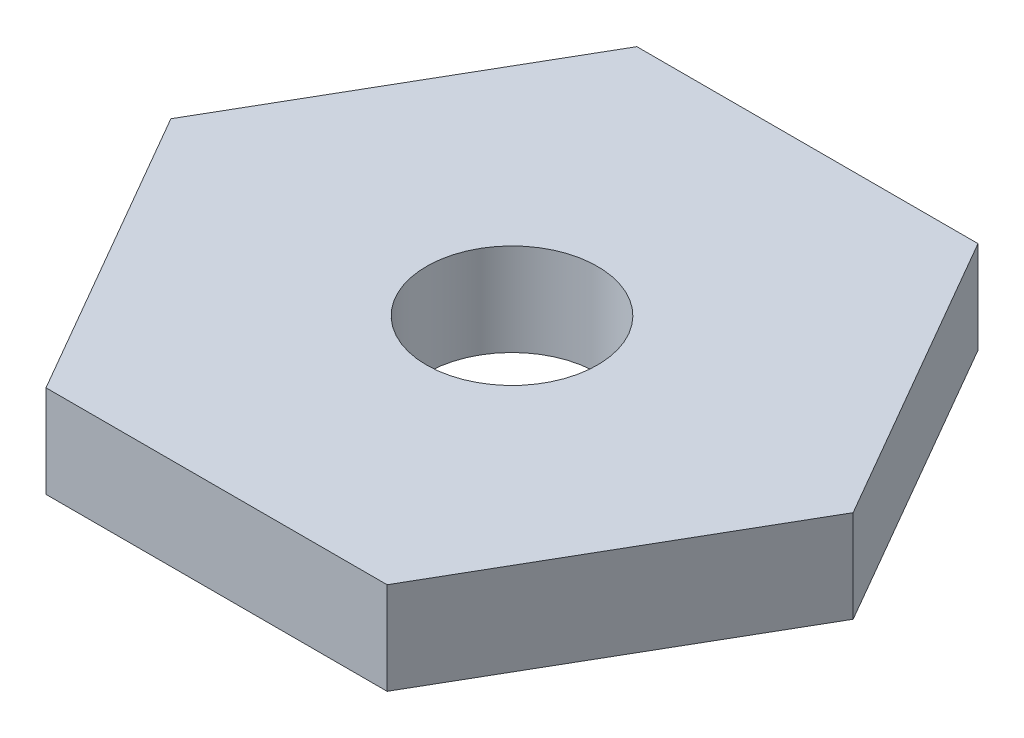
from build123d import *

# Parameters (mm, degrees)
ESQUISSE1_R        = 9.259370784
BOSS_EXTRU_1_DEPTH = 10


with BuildPart() as part:
    # Esquisse1 → Boss.-Extru.1 (new body)
    with BuildSketch(Plane(origin=(0, 0, 0), x_dir=(1, 0, 0), z_dir=(0, 1, 0))):
        Polygon((36.950417228, 0), (18.475208614, 32), (-18.475208614, 32), (-36.950417228, 0), (-18.475208614, -32), (18.475208614, -32), align=None)
        Circle(ESQUISSE1_R, mode=Mode.SUBTRACT)
    extrude(amount=BOSS_EXTRU_1_DEPTH)


solid = part.part
